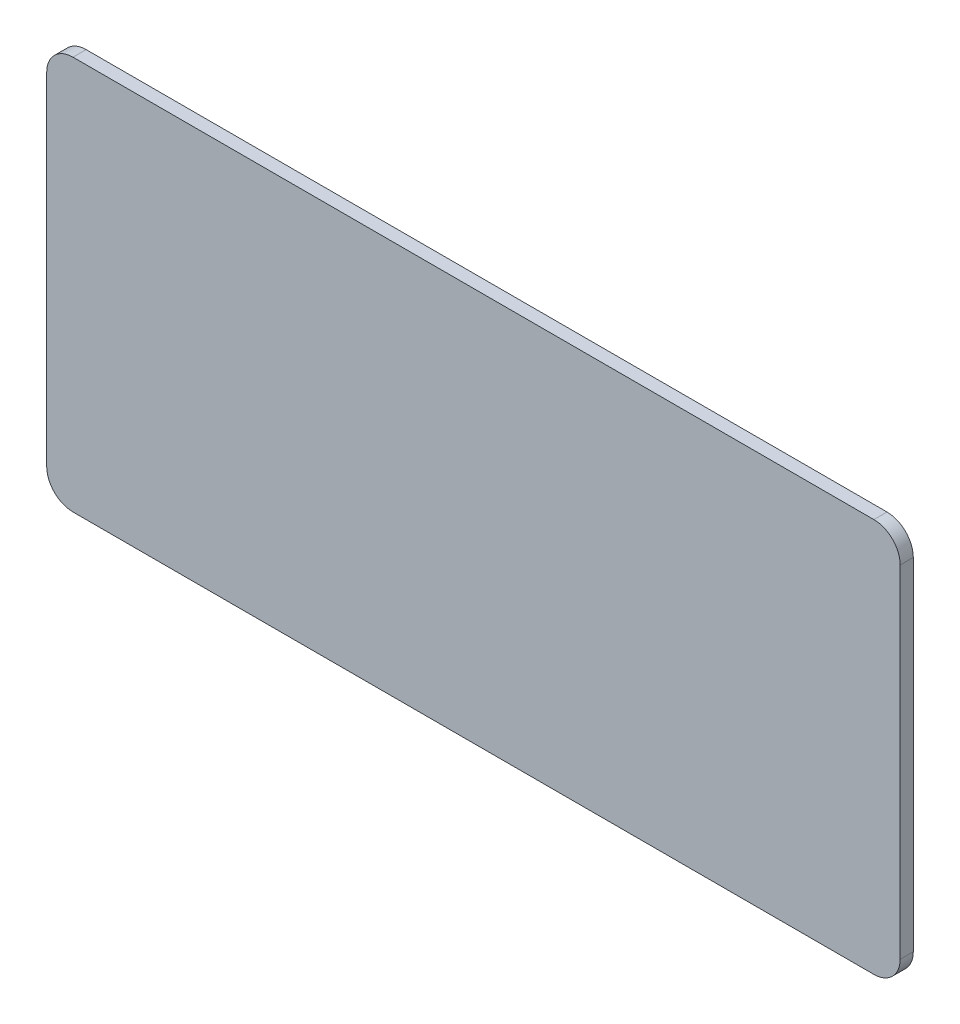
from build123d import *

# Parameters (mm, degrees)
BOSS_EXTRUDE1_DEPTH = 1
BOSS_EXTRUDE2_DEPTH = 1


with BuildPart() as part:
    # Sketch1 → Boss-Extrude1 (new body)
    with BuildSketch(Plane.XY):
        with BuildLine():
            Line((93.44074046, -13.055), (93.44074046, 12.945))
            ThreePointArc((93.44074046, 12.945), (94.026526898, 14.359213562), (95.44074046, 14.945))
            Line((95.44074046, 14.945), (156.44074046, 14.945))
            ThreePointArc((156.44074046, 14.945), (157.854954022, 14.359213562), (158.44074046, 12.945))
            Line((158.44074046, 12.945), (158.44074046, -13.055))
            ThreePointArc((158.44074046, -13.055), (157.854954022, -14.469213562), (156.44074046, -15.055))
            Line((156.44074046, -15.055), (95.44074046, -15.055))
            ThreePointArc((95.44074046, -15.055), (94.026526898, -14.469213562), (93.44074046, -13.055))
        make_face()
    extrude(amount=-BOSS_EXTRUDE1_DEPTH)


with BuildPart() as body_2:
    # Sketch2 → Boss-Extrude2 (new body)
    with BuildSketch(Plane(origin=(0, 0, -1), x_dir=(-1, 0, 0), z_dir=(0, 0, -1))):
        with BuildLine():
            Line((-148.44074046, 9.445), (-103.44074046, 9.445))
            ThreePointArc((-103.44074046, 9.445), (-101.672973507, 8.712766953), (-100.94074046, 6.945))
            Line((-100.94074046, 6.945), (-100.94074046, -7.055))
            ThreePointArc((-100.94074046, -7.055), (-101.672973507, -8.822766953), (-103.44074046, -9.555))
            Line((-103.44074046, -9.555), (-148.44074046, -9.555))
            ThreePointArc((-148.44074046, -9.555), (-150.208507413, -8.822766953), (-150.94074046, -7.055))
            Line((-150.94074046, -7.055), (-150.94074046, 6.945))
            ThreePointArc((-150.94074046, 6.945), (-150.208507413, 8.712766953), (-148.44074046, 9.445))
        make_face()
    extrude(amount=BOSS_EXTRUDE2_DEPTH)


solid = Compound([part.part, body_2.part])
